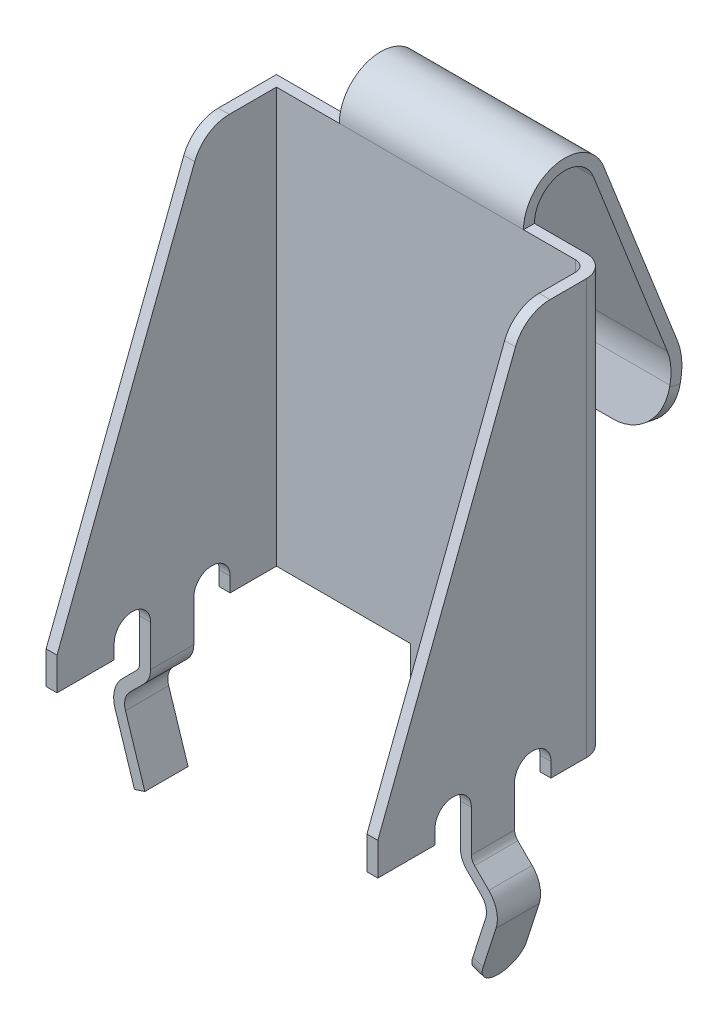
from build123d import *

# Parameters (mm, degrees)
SKETCH1_W                       = 9.13
SKETCH1_H                       = 0.3
BOSS_EXTRUDE1_DEPTH             = 11.42
BOSS_EXTRUDE2_DEPTH             = 2.535
FILLET1_R                       = 1.3
BOSS_EXTRUDE3_DEPTH             = 0.3
BOSS_EXTRUDE4_DEPTH             = 0.3
FILLET2_R                       = 0.3
FILLET3_R                       = 0.6
BOSS_EXTRUDE5_REACH             = 17.194
BOSS_EXTRUDE5_DIRECTION_2_REACH = 17.194
FILLET4_R                       = 0.595


with BuildPart() as part:
    # Sketch1 → Boss-Extrude1 (new body)
    with BuildSketch(Plane(origin=(0, 0, 0), x_dir=(1, 0, 0), z_dir=(0, 1, 0))):
        Rectangle(SKETCH1_W, SKETCH1_H)
    extrude(amount=BOSS_EXTRUDE1_DEPTH)

    # Sketch2 → Boss-Extrude2 (add, symmetric)
    with BuildSketch(Plane(origin=(0, 0, 0), x_dir=(0, 0, -1), z_dir=(1, 0, 0))):
        with BuildLine():
            Line((-0.15, 11.42), (0.15, 11.42))
            ThreePointArc((0.15, 11.42), (0.83370873, 12.245332078), (1.771840569, 11.727124282))
            Line((1.771840569, 11.727124282), (3.806143873, 6.548436218))
            ThreePointArc((3.806143873, 6.548436218), (3.904386052, 6.129654649), (3.879736877, 5.700210886))
            Line((3.879736877, 5.700210886), (3.610438676, 4.379957823))
            Line((3.610438676, 4.379957823), (3.904386052, 4.32))
            Line((3.904386052, 4.32), (4.173684252, 5.640253063))
            ThreePointArc((4.173684252, 5.640253063), (4.203263262, 6.155585579), (4.085372648, 6.658123461))
            Line((4.085372648, 6.658123461), (2.051069344, 11.836811525))
            ThreePointArc((2.051069344, 11.836811525), (0.77789042, 12.540093534), (-0.15, 11.42))
        make_face()
    extrude(amount=BOSS_EXTRUDE2_DEPTH, both=True)

    # Fillet1
    fillet1_edges = [part.edges().sort_by_distance(p)[0] for p in [
        (-2.535, 4.349978911, -3.757412364),
        (2.535, 4.349978911, -3.757412364),
    ]]
    fillet(fillet1_edges, radius=FILLET1_R)

    # Sketch3 → Boss-Extrude3 (add)
    with BuildSketch(Plane(origin=(0, 0, -0.15), x_dir=(-1, 0, 0), z_dir=(0, 0, -1))):
        with BuildLine():
            Line((-0.57, 0), (0.57, 0))
            Line((0.57, 0), (0.57, -1.6))
            Line((0.57, -1.6), (0.33, -2.770784784))
            ThreePointArc((0.33, -2.770784784), (0, -3.04), (-0.33, -2.770784784))
            Line((-0.33, -2.770784784), (-0.57, -1.6))
            Line((-0.57, -1.6), (-0.57, 0))
        make_face()
    extrude(amount=-BOSS_EXTRUDE3_DEPTH)

    # Sketch4 → Boss-Extrude4 (add)
    with BuildSketch(Plane(origin=(4.565, 0, 0), x_dir=(0, 0, -1), z_dir=(1, 0, 0))):
        with BuildLine():
            Line((-0.15, 11.42), (-0.15, 0))
            Line((-0.15, 0), (-1.425, 0))
            Line((-1.425, 0), (-1.425, 0.4))
            ThreePointArc((-1.425, 0.4), (-1.925, 0.9), (-2.425, 0.4))
            Line((-2.425, 0.4), (-2.425, 0))
            Line((-2.425, 0), (-3.615, 0))
            Line((-3.615, 0), (-3.615, 0.4))
            ThreePointArc((-3.615, 0.4), (-4.115, 0.9), (-4.615, 0.4))
            Line((-4.615, 0.4), (-4.615, 0))
            Line((-4.615, 0), (-6.19, 0))
            Line((-6.19, 0), (-6.19, 0.9))
            Line((-6.19, 0.9), (-2.4, 10.767226789))
            ThreePointArc((-2.4, 10.767226789), (-2.026327352, 11.241078061), (-1.45, 11.42))
            Line((-1.45, 11.42), (-0.15, 11.42))
        make_face()
    boss_extrude4 = extrude(amount=-BOSS_EXTRUDE4_DEPTH)

    # Fillet2
    fillet2_edges = [part.edges().sort_by_distance(p)[0] for p in [
        (4.265, 5.71, 0.15),
    ]]
    fillet(fillet2_edges, radius=FILLET2_R)

    # Fillet3
    fillet3_edges = [part.edges().sort_by_distance(p)[0] for p in [
        (4.565, 5.71, -0.15),
    ]]
    fillet(fillet3_edges, radius=FILLET3_R)

    # Boss-Extrude5: up to this face of the body (flat: up to its plane)
    boss_extrude5_end = Plane(part.part.faces().sort_by_distance((4.415, 0.2, 2.425))[0])
    # Sketch5 → Boss-Extrude5 (add, up to the picked face)
    with BuildSketch(Plane(origin=(0, 0, 3.02), x_dir=(-1, 0, 0), z_dir=(0, 0, -1)), mode=Mode.PRIVATE) as boss_extrude5_sk1:
        with BuildLine():
            Line((-4.565, 0), (-4.265, 0))
            Line((-4.265, 0), (-4.265, -0.734365081))
            ThreePointArc((-4.265, -0.734365081), (-4.31067228, -0.963975141), (-4.440735931, -1.15862915))
            Line((-4.440735931, -1.15862915), (-4.833553391, -1.551446609))
            ThreePointArc((-4.833553391, -1.551446609), (-4.966005966, -1.787534255), (-4.95599841, -2.058053958))
            Line((-4.95599841, -2.058053958), (-4.422200477, -3.718167625))
            Line((-4.422200477, -3.718167625), (-4.707799523, -3.81))
            Line((-4.707799523, -3.81), (-5.241597456, -2.149886332))
            ThreePointArc((-5.241597456, -2.149886332), (-5.257609545, -1.717054807), (-5.045685425, -1.339314575))
            Line((-5.045685425, -1.339314575), (-4.652867966, -0.946497116))
            ThreePointArc((-4.652867966, -0.946497116), (-4.58783614, -0.849170111), (-4.565, -0.734365081))
            Line((-4.565, -0.734365081), (-4.565, 0))
        make_face()
    boss_extrude5_tool1 = split(extrude(boss_extrude5_sk1.sketch, amount=BOSS_EXTRUDE5_REACH, mode=Mode.PRIVATE), bisect_by=boss_extrude5_end, keep=Keep.BOTH, mode=Mode.PRIVATE)
    boss_extrude5 = boss_extrude5_tool1.solids().sort_by(Axis((4.415, -0.039429, 3.02), (0, 0, -1)))[0]
    add(boss_extrude5)

    # Boss-Extrude5 direction 2: up to this face of the body (flat: up to its plane)
    boss_extrude5_direction_2_end = Plane(part.part.faces().sort_by_distance((4.415, 0.2, 3.615))[0])
    # Sketch5 → Boss-Extrude5 direction 2 (add, up to the picked face)
    with BuildSketch(Plane(origin=(0, 0, 3.02), x_dir=(-1, 0, 0), z_dir=(0, 0, -1)), mode=Mode.PRIVATE) as boss_extrude5_direction_2_sk1:
        with BuildLine():
            Line((-4.565, 0), (-4.265, 0))
            Line((-4.265, 0), (-4.265, -0.734365081))
            ThreePointArc((-4.265, -0.734365081), (-4.31067228, -0.963975141), (-4.440735931, -1.15862915))
            Line((-4.440735931, -1.15862915), (-4.833553391, -1.551446609))
            ThreePointArc((-4.833553391, -1.551446609), (-4.966005966, -1.787534255), (-4.95599841, -2.058053958))
            Line((-4.95599841, -2.058053958), (-4.422200477, -3.718167625))
            Line((-4.422200477, -3.718167625), (-4.707799523, -3.81))
            Line((-4.707799523, -3.81), (-5.241597456, -2.149886332))
            ThreePointArc((-5.241597456, -2.149886332), (-5.257609545, -1.717054807), (-5.045685425, -1.339314575))
            Line((-5.045685425, -1.339314575), (-4.652867966, -0.946497116))
            ThreePointArc((-4.652867966, -0.946497116), (-4.58783614, -0.849170111), (-4.565, -0.734365081))
            Line((-4.565, -0.734365081), (-4.565, 0))
        make_face()
    boss_extrude5_direction_2_tool1 = split(extrude(boss_extrude5_direction_2_sk1.sketch, amount=-BOSS_EXTRUDE5_DIRECTION_2_REACH, mode=Mode.PRIVATE), bisect_by=boss_extrude5_direction_2_end, keep=Keep.BOTH, mode=Mode.PRIVATE)
    boss_extrude5_direction_2 = boss_extrude5_direction_2_tool1.solids().sort_by(Axis((4.415, -0.039429, 3.02), (0, 0, 1)))[0]
    add(boss_extrude5_direction_2)

    # Fillet4
    fillet4_edges = [part.edges().sort_by_distance(p)[0] for p in [
        (4.565, -3.764083813, 2.425),
        (4.565, -3.764083813, 3.615),
    ]]
    fillet(fillet4_edges, radius=FILLET4_R - 0.0001)  # a hair under: the kernel refuses the full size

    # Mirror1: Boss-Extrude4, Boss-Extrude5, Boss-Extrude5 direction 2 across plane
    add(boss_extrude4.mirror(Plane(origin=(0, 0, 0), x_dir=(0, 0, 1), z_dir=(1, 0, 0))))
    add(boss_extrude5.mirror(Plane(origin=(0, 0, 0), x_dir=(0, 0, 1), z_dir=(1, 0, 0))))
    add(boss_extrude5_direction_2.mirror(Plane(origin=(0, 0, 0), x_dir=(0, 0, 1), z_dir=(1, 0, 0))))


solid = part.part
